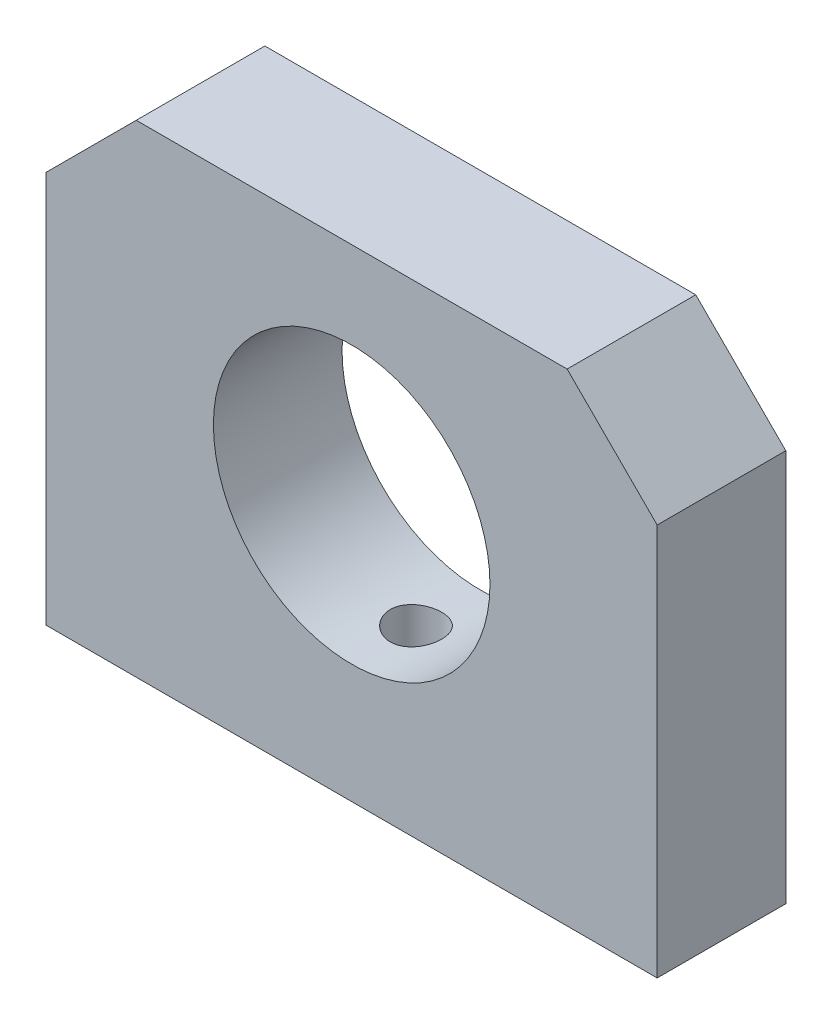
from build123d import *

# Parameters (mm, degrees)
SCHIZZO1_R                   = 21.5
ESTRUSIONE_ESTRUSIONE1_DEPTH = 20
SCHIZZO2_R                   = 4
TAGLIO_ESTRUSIONE1_DEPTH     = 20


with BuildPart() as part:
    # Schizzo1 → Estrusione-Estrusione1 (new body)
    with BuildSketch(Plane.XY):
        Polygon((0, 0), (95, 0), (95, 61), (81, 75), (14, 75), (0, 61), align=None)
        with Locations((47.5, 40)):
            Circle(SCHIZZO1_R, mode=Mode.SUBTRACT)
    extrude(amount=ESTRUSIONE_ESTRUSIONE1_DEPTH)

    # Schizzo2 → Taglio-Estrusione1 (cut)
    with BuildSketch(Plane.XZ):
        with Locations((47.5, 10)):
            Circle(SCHIZZO2_R)
        with Locations((17.5, 10)):
            Circle(SCHIZZO2_R)
        with Locations((77.5, 10)):
            Circle(SCHIZZO2_R)
    extrude(amount=-TAGLIO_ESTRUSIONE1_DEPTH, mode=Mode.SUBTRACT)


solid = part.part
